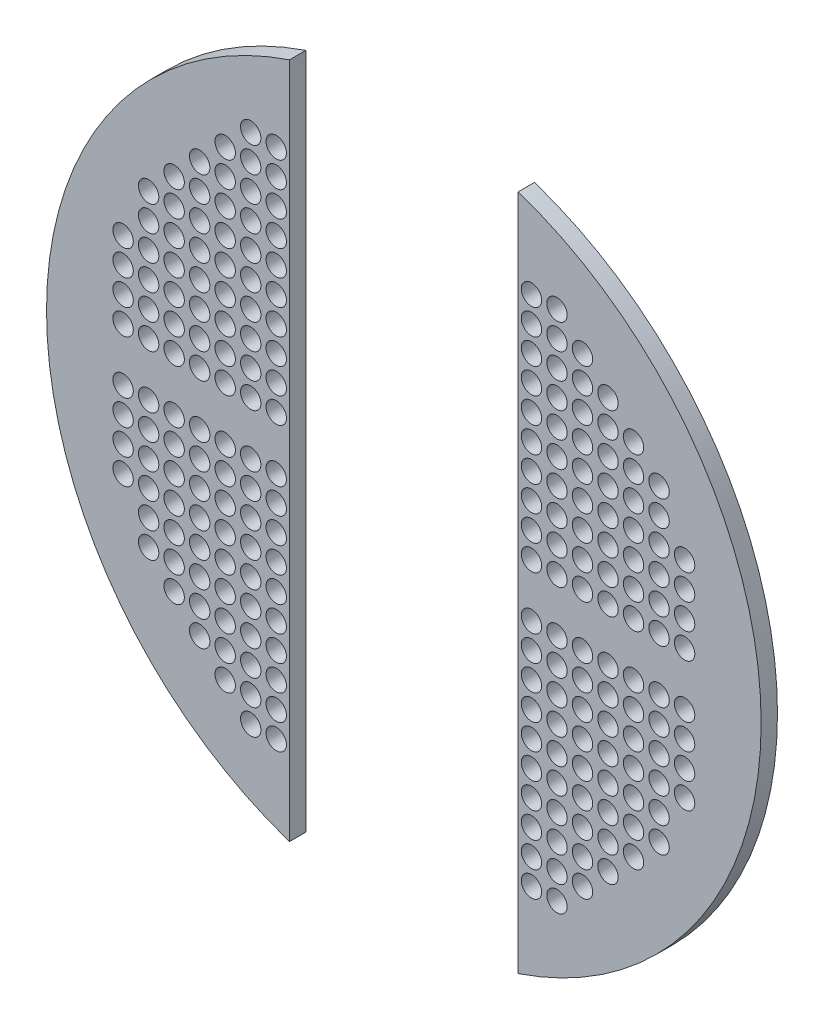
from build123d import *

# Parameters (mm, degrees)
SKETCH1_R           = 444.5
BOSS_EXTRUDE1_DEPTH = 20.32
SKETCH4_R           = 12.7
CUT_EXTRUDE1_DEPTH  = 76.2
SKETCH5_W           = 284.48
SKETCH5_H           = 949.521920759
CUT_EXTRUDE2_DEPTH  = 50.8


with BuildPart() as part:
    # Sketch1 → Boss-Extrude1 (new body)
    with BuildSketch(Plane.XY):
        Circle(SKETCH1_R)
    extrude(amount=-BOSS_EXTRUDE1_DEPTH)

    # Sketch4 → Cut-Extrude1 (cut)
    with BuildSketch(Plane.XY):
        with Locations((0, 33.02)):
            Circle(SKETCH4_R)
        with Locations((-31.75, 33.02)):
            Circle(SKETCH4_R)
        with Locations((-63.5, 33.02)):
            Circle(SKETCH4_R)
        with Locations((-95.25, 33.02)):
            Circle(SKETCH4_R)
        with Locations((-127, 33.02)):
            Circle(SKETCH4_R)
        with Locations((-158.75, 33.02)):
            Circle(SKETCH4_R)
        with Locations((-190.5, 33.02)):
            Circle(SKETCH4_R)
        with Locations((-222.25, 33.02)):
            Circle(SKETCH4_R)
        with Locations((-254, 33.02)):
            Circle(SKETCH4_R)
        with Locations((-285.75, 33.02)):
            Circle(SKETCH4_R)
        with Locations((-317.5, 33.02)):
            Circle(SKETCH4_R)
        with Locations((-349.25, 33.02)):
            Circle(SKETCH4_R)
        with Locations((-31.75, 64.77)):
            Circle(SKETCH4_R)
        with Locations((-63.5, 64.77)):
            Circle(SKETCH4_R)
        with Locations((-95.25, 64.77)):
            Circle(SKETCH4_R)
        with Locations((-127, 64.77)):
            Circle(SKETCH4_R)
        with Locations((-158.75, 64.77)):
            Circle(SKETCH4_R)
        with Locations((-190.5, 64.77)):
            Circle(SKETCH4_R)
        with Locations((-222.25, 64.77)):
            Circle(SKETCH4_R)
        with Locations((-254, 64.77)):
            Circle(SKETCH4_R)
        with Locations((-285.75, 64.77)):
            Circle(SKETCH4_R)
        with Locations((-317.5, 64.77)):
            Circle(SKETCH4_R)
        with Locations((-349.25, 64.77)):
            Circle(SKETCH4_R)
        with Locations((-31.75, 96.52)):
            Circle(SKETCH4_R)
        with Locations((-63.5, 96.52)):
            Circle(SKETCH4_R)
        with Locations((-95.25, 96.52)):
            Circle(SKETCH4_R)
        with Locations((-127, 96.52)):
            Circle(SKETCH4_R)
        with Locations((-158.75, 96.52)):
            Circle(SKETCH4_R)
        with Locations((-190.5, 96.52)):
            Circle(SKETCH4_R)
        with Locations((-222.25, 96.52)):
            Circle(SKETCH4_R)
        with Locations((-254, 96.52)):
            Circle(SKETCH4_R)
        with Locations((-285.75, 96.52)):
            Circle(SKETCH4_R)
        with Locations((-317.5, 96.52)):
            Circle(SKETCH4_R)
        with Locations((-349.25, 96.52)):
            Circle(SKETCH4_R)
        with Locations((-31.75, 128.27)):
            Circle(SKETCH4_R)
        with Locations((-63.5, 128.27)):
            Circle(SKETCH4_R)
        with Locations((-95.25, 128.27)):
            Circle(SKETCH4_R)
        with Locations((-127, 128.27)):
            Circle(SKETCH4_R)
        with Locations((-158.75, 128.27)):
            Circle(SKETCH4_R)
        with Locations((-190.5, 128.27)):
            Circle(SKETCH4_R)
        with Locations((-222.25, 128.27)):
            Circle(SKETCH4_R)
        with Locations((-254, 128.27)):
            Circle(SKETCH4_R)
        with Locations((-285.75, 128.27)):
            Circle(SKETCH4_R)
        with Locations((-317.5, 128.27)):
            Circle(SKETCH4_R)
        with Locations((-349.25, 128.27)):
            Circle(SKETCH4_R)
        with Locations((-31.75, 160.02)):
            Circle(SKETCH4_R)
        with Locations((-63.5, 160.02)):
            Circle(SKETCH4_R)
        with Locations((-95.25, 160.02)):
            Circle(SKETCH4_R)
        with Locations((-127, 160.02)):
            Circle(SKETCH4_R)
        with Locations((-158.75, 160.02)):
            Circle(SKETCH4_R)
        with Locations((-190.5, 160.02)):
            Circle(SKETCH4_R)
        with Locations((-222.25, 160.02)):
            Circle(SKETCH4_R)
        with Locations((-254, 160.02)):
            Circle(SKETCH4_R)
        with Locations((-285.75, 160.02)):
            Circle(SKETCH4_R)
        with Locations((-317.5, 160.02)):
            Circle(SKETCH4_R)
        with Locations((-31.75, 191.77)):
            Circle(SKETCH4_R)
        with Locations((-63.5, 191.77)):
            Circle(SKETCH4_R)
        with Locations((-95.25, 191.77)):
            Circle(SKETCH4_R)
        with Locations((-127, 191.77)):
            Circle(SKETCH4_R)
        with Locations((-158.75, 191.77)):
            Circle(SKETCH4_R)
        with Locations((-190.5, 191.77)):
            Circle(SKETCH4_R)
        with Locations((-222.25, 191.77)):
            Circle(SKETCH4_R)
        with Locations((-254, 191.77)):
            Circle(SKETCH4_R)
        with Locations((-285.75, 191.77)):
            Circle(SKETCH4_R)
        with Locations((-317.5, 191.77)):
            Circle(SKETCH4_R)
        with Locations((-31.75, 223.52)):
            Circle(SKETCH4_R)
        with Locations((-63.5, 223.52)):
            Circle(SKETCH4_R)
        with Locations((-95.25, 223.52)):
            Circle(SKETCH4_R)
        with Locations((-127, 223.52)):
            Circle(SKETCH4_R)
        with Locations((-158.75, 223.52)):
            Circle(SKETCH4_R)
        with Locations((-190.5, 223.52)):
            Circle(SKETCH4_R)
        with Locations((-222.25, 223.52)):
            Circle(SKETCH4_R)
        with Locations((-254, 223.52)):
            Circle(SKETCH4_R)
        with Locations((-285.75, 223.52)):
            Circle(SKETCH4_R)
        with Locations((-31.75, 255.27)):
            Circle(SKETCH4_R)
        with Locations((-63.5, 255.27)):
            Circle(SKETCH4_R)
        with Locations((-95.25, 255.27)):
            Circle(SKETCH4_R)
        with Locations((-127, 255.27)):
            Circle(SKETCH4_R)
        with Locations((-158.75, 255.27)):
            Circle(SKETCH4_R)
        with Locations((-190.5, 255.27)):
            Circle(SKETCH4_R)
        with Locations((-222.25, 255.27)):
            Circle(SKETCH4_R)
        with Locations((-254, 255.27)):
            Circle(SKETCH4_R)
        with Locations((-31.75, 287.02)):
            Circle(SKETCH4_R)
        with Locations((-63.5, 287.02)):
            Circle(SKETCH4_R)
        with Locations((-95.25, 287.02)):
            Circle(SKETCH4_R)
        with Locations((-127, 287.02)):
            Circle(SKETCH4_R)
        with Locations((-158.75, 287.02)):
            Circle(SKETCH4_R)
        with Locations((-190.5, 287.02)):
            Circle(SKETCH4_R)
        with Locations((-222.25, 287.02)):
            Circle(SKETCH4_R)
        with Locations((-31.75, 318.77)):
            Circle(SKETCH4_R)
        with Locations((-63.5, 318.77)):
            Circle(SKETCH4_R)
        with Locations((-95.25, 318.77)):
            Circle(SKETCH4_R)
        with Locations((-127, 318.77)):
            Circle(SKETCH4_R)
        with Locations((-158.75, 318.77)):
            Circle(SKETCH4_R)
        with Locations((-190.5, 318.77)):
            Circle(SKETCH4_R)
        with Locations((-31.75, 350.52)):
            Circle(SKETCH4_R)
        with Locations((-63.5, 350.52)):
            Circle(SKETCH4_R)
        with Locations((-95.25, 350.52)):
            Circle(SKETCH4_R)
        with Locations((-127, 350.52)):
            Circle(SKETCH4_R)
        with Locations((-31.75, 382.27)):
            Circle(SKETCH4_R)
        with Locations((0, 64.77)):
            Circle(SKETCH4_R)
        with Locations((0, 96.52)):
            Circle(SKETCH4_R)
        with Locations((0, 128.27)):
            Circle(SKETCH4_R)
        with Locations((0, 160.02)):
            Circle(SKETCH4_R)
        with Locations((0, 191.77)):
            Circle(SKETCH4_R)
        with Locations((0, 223.52)):
            Circle(SKETCH4_R)
        with Locations((0, 255.27)):
            Circle(SKETCH4_R)
        with Locations((0, 287.02)):
            Circle(SKETCH4_R)
        with Locations((0, 318.77)):
            Circle(SKETCH4_R)
        with Locations((0, 350.52)):
            Circle(SKETCH4_R)
        with Locations((0, 382.27)):
            Circle(SKETCH4_R)
        with Locations((63.5, 350.52)):
            Circle(SKETCH4_R)
        with Locations((31.75, 350.52)):
            Circle(SKETCH4_R)
        with Locations((63.5, 318.77)):
            Circle(SKETCH4_R)
        with Locations((31.75, 318.77)):
            Circle(SKETCH4_R)
        with Locations((31.75, 287.02)):
            Circle(SKETCH4_R)
        with Locations((63.5, 255.27)):
            Circle(SKETCH4_R)
        with Locations((31.75, 255.27)):
            Circle(SKETCH4_R)
        with Locations((63.5, 223.52)):
            Circle(SKETCH4_R)
        with Locations((31.75, 223.52)):
            Circle(SKETCH4_R)
        with Locations((31.75, 191.77)):
            Circle(SKETCH4_R)
        with Locations((63.5, 160.02)):
            Circle(SKETCH4_R)
        with Locations((31.75, 160.02)):
            Circle(SKETCH4_R)
        with Locations((63.5, 128.27)):
            Circle(SKETCH4_R)
        with Locations((31.75, 128.27)):
            Circle(SKETCH4_R)
        with Locations((349.25, 96.52)):
            Circle(SKETCH4_R)
        with Locations((317.5, 96.52)):
            Circle(SKETCH4_R)
        with Locations((285.75, 96.52)):
            Circle(SKETCH4_R)
        with Locations((254, 96.52)):
            Circle(SKETCH4_R)
        with Locations((222.25, 96.52)):
            Circle(SKETCH4_R)
        with Locations((190.5, 96.52)):
            Circle(SKETCH4_R)
        with Locations((158.75, 96.52)):
            Circle(SKETCH4_R)
        with Locations((127, 96.52)):
            Circle(SKETCH4_R)
        with Locations((95.25, 96.52)):
            Circle(SKETCH4_R)
        with Locations((63.5, 96.52)):
            Circle(SKETCH4_R)
        with Locations((31.75, 96.52)):
            Circle(SKETCH4_R)
        with Locations((349.25, 64.77)):
            Circle(SKETCH4_R)
        with Locations((317.5, 64.77)):
            Circle(SKETCH4_R)
        with Locations((285.75, 64.77)):
            Circle(SKETCH4_R)
        with Locations((254, 64.77)):
            Circle(SKETCH4_R)
        with Locations((222.25, 64.77)):
            Circle(SKETCH4_R)
        with Locations((190.5, 64.77)):
            Circle(SKETCH4_R)
        with Locations((158.75, 64.77)):
            Circle(SKETCH4_R)
        with Locations((127, 64.77)):
            Circle(SKETCH4_R)
        with Locations((95.25, 64.77)):
            Circle(SKETCH4_R)
        with Locations((63.5, 64.77)):
            Circle(SKETCH4_R)
        with Locations((31.75, 64.77)):
            Circle(SKETCH4_R)
        with Locations((349.25, 33.02)):
            Circle(SKETCH4_R)
        with Locations((317.5, 33.02)):
            Circle(SKETCH4_R)
        with Locations((285.75, 33.02)):
            Circle(SKETCH4_R)
        with Locations((254, 33.02)):
            Circle(SKETCH4_R)
        with Locations((222.25, 33.02)):
            Circle(SKETCH4_R)
        with Locations((190.5, 33.02)):
            Circle(SKETCH4_R)
        with Locations((158.75, 33.02)):
            Circle(SKETCH4_R)
        with Locations((127, 33.02)):
            Circle(SKETCH4_R)
        with Locations((95.25, 33.02)):
            Circle(SKETCH4_R)
        with Locations((63.5, 33.02)):
            Circle(SKETCH4_R)
        with Locations((31.75, 33.02)):
            Circle(SKETCH4_R)
        with Locations((127, 350.52)):
            Circle(SKETCH4_R)
        with Locations((95.25, 350.52)):
            Circle(SKETCH4_R)
        with Locations((190.5, 318.77)):
            Circle(SKETCH4_R)
        with Locations((127, 318.77)):
            Circle(SKETCH4_R)
        with Locations((95.25, 318.77)):
            Circle(SKETCH4_R)
        with Locations((222.25, 287.02)):
            Circle(SKETCH4_R)
        with Locations((190.5, 287.02)):
            Circle(SKETCH4_R)
        with Locations((158.75, 287.02)):
            Circle(SKETCH4_R)
        with Locations((95.25, 287.02)):
            Circle(SKETCH4_R)
        with Locations((254, 255.27)):
            Circle(SKETCH4_R)
        with Locations((222.25, 255.27)):
            Circle(SKETCH4_R)
        with Locations((190.5, 255.27)):
            Circle(SKETCH4_R)
        with Locations((158.75, 255.27)):
            Circle(SKETCH4_R)
        with Locations((127, 255.27)):
            Circle(SKETCH4_R)
        with Locations((95.25, 255.27)):
            Circle(SKETCH4_R)
        with Locations((285.75, 223.52)):
            Circle(SKETCH4_R)
        with Locations((254, 223.52)):
            Circle(SKETCH4_R)
        with Locations((222.25, 223.52)):
            Circle(SKETCH4_R)
        with Locations((158.75, 223.52)):
            Circle(SKETCH4_R)
        with Locations((127, 223.52)):
            Circle(SKETCH4_R)
        with Locations((95.25, 223.52)):
            Circle(SKETCH4_R)
        with Locations((317.5, 191.77)):
            Circle(SKETCH4_R)
        with Locations((285.75, 191.77)):
            Circle(SKETCH4_R)
        with Locations((254, 191.77)):
            Circle(SKETCH4_R)
        with Locations((222.25, 191.77)):
            Circle(SKETCH4_R)
        with Locations((190.5, 191.77)):
            Circle(SKETCH4_R)
        with Locations((158.75, 191.77)):
            Circle(SKETCH4_R)
        with Locations((127, 191.77)):
            Circle(SKETCH4_R)
        with Locations((95.25, 191.77)):
            Circle(SKETCH4_R)
        with Locations((317.5, 160.02)):
            Circle(SKETCH4_R)
        with Locations((285.75, 160.02)):
            Circle(SKETCH4_R)
        with Locations((254, 160.02)):
            Circle(SKETCH4_R)
        with Locations((222.25, 160.02)):
            Circle(SKETCH4_R)
        with Locations((190.5, 160.02)):
            Circle(SKETCH4_R)
        with Locations((158.75, 160.02)):
            Circle(SKETCH4_R)
        with Locations((127, 160.02)):
            Circle(SKETCH4_R)
        with Locations((95.25, 160.02)):
            Circle(SKETCH4_R)
        with Locations((349.25, 128.27)):
            Circle(SKETCH4_R)
        with Locations((317.5, 128.27)):
            Circle(SKETCH4_R)
        with Locations((285.75, 128.27)):
            Circle(SKETCH4_R)
        with Locations((254, 128.27)):
            Circle(SKETCH4_R)
        with Locations((222.25, 128.27)):
            Circle(SKETCH4_R)
        with Locations((190.5, 128.27)):
            Circle(SKETCH4_R)
        with Locations((158.75, 128.27)):
            Circle(SKETCH4_R)
        with Locations((127, 128.27)):
            Circle(SKETCH4_R)
        with Locations((95.25, 128.27)):
            Circle(SKETCH4_R)
        with Locations((127, 287.02)):
            Circle(SKETCH4_R)
        with Locations((63.5, 287.02)):
            Circle(SKETCH4_R)
        with Locations((63.5, 191.77)):
            Circle(SKETCH4_R)
        with Locations((190.5, 223.52)):
            Circle(SKETCH4_R)
        with Locations((158.75, 318.77)):
            Circle(SKETCH4_R)
        with Locations((31.75, 382.27)):
            Circle(SKETCH4_R)
        with Locations((31.75, -382.27)):
            Circle(SKETCH4_R)
        with Locations((158.75, -318.77)):
            Circle(SKETCH4_R)
        with Locations((190.5, -223.52)):
            Circle(SKETCH4_R)
        with Locations((63.5, -191.77)):
            Circle(SKETCH4_R)
        with Locations((63.5, -287.02)):
            Circle(SKETCH4_R)
        with Locations((127, -287.02)):
            Circle(SKETCH4_R)
        with Locations((95.25, -128.27)):
            Circle(SKETCH4_R)
        with Locations((127, -128.27)):
            Circle(SKETCH4_R)
        with Locations((158.75, -128.27)):
            Circle(SKETCH4_R)
        with Locations((190.5, -128.27)):
            Circle(SKETCH4_R)
        with Locations((222.25, -128.27)):
            Circle(SKETCH4_R)
        with Locations((254, -128.27)):
            Circle(SKETCH4_R)
        with Locations((285.75, -128.27)):
            Circle(SKETCH4_R)
        with Locations((317.5, -128.27)):
            Circle(SKETCH4_R)
        with Locations((349.25, -128.27)):
            Circle(SKETCH4_R)
        with Locations((95.25, -160.02)):
            Circle(SKETCH4_R)
        with Locations((127, -160.02)):
            Circle(SKETCH4_R)
        with Locations((158.75, -160.02)):
            Circle(SKETCH4_R)
        with Locations((190.5, -160.02)):
            Circle(SKETCH4_R)
        with Locations((222.25, -160.02)):
            Circle(SKETCH4_R)
        with Locations((254, -160.02)):
            Circle(SKETCH4_R)
        with Locations((285.75, -160.02)):
            Circle(SKETCH4_R)
        with Locations((317.5, -160.02)):
            Circle(SKETCH4_R)
        with Locations((95.25, -191.77)):
            Circle(SKETCH4_R)
        with Locations((127, -191.77)):
            Circle(SKETCH4_R)
        with Locations((158.75, -191.77)):
            Circle(SKETCH4_R)
        with Locations((190.5, -191.77)):
            Circle(SKETCH4_R)
        with Locations((222.25, -191.77)):
            Circle(SKETCH4_R)
        with Locations((254, -191.77)):
            Circle(SKETCH4_R)
        with Locations((285.75, -191.77)):
            Circle(SKETCH4_R)
        with Locations((317.5, -191.77)):
            Circle(SKETCH4_R)
        with Locations((95.25, -223.52)):
            Circle(SKETCH4_R)
        with Locations((127, -223.52)):
            Circle(SKETCH4_R)
        with Locations((158.75, -223.52)):
            Circle(SKETCH4_R)
        with Locations((222.25, -223.52)):
            Circle(SKETCH4_R)
        with Locations((254, -223.52)):
            Circle(SKETCH4_R)
        with Locations((285.75, -223.52)):
            Circle(SKETCH4_R)
        with Locations((95.25, -255.27)):
            Circle(SKETCH4_R)
        with Locations((127, -255.27)):
            Circle(SKETCH4_R)
        with Locations((158.75, -255.27)):
            Circle(SKETCH4_R)
        with Locations((190.5, -255.27)):
            Circle(SKETCH4_R)
        with Locations((222.25, -255.27)):
            Circle(SKETCH4_R)
        with Locations((254, -255.27)):
            Circle(SKETCH4_R)
        with Locations((95.25, -287.02)):
            Circle(SKETCH4_R)
        with Locations((158.75, -287.02)):
            Circle(SKETCH4_R)
        with Locations((190.5, -287.02)):
            Circle(SKETCH4_R)
        with Locations((222.25, -287.02)):
            Circle(SKETCH4_R)
        with Locations((95.25, -318.77)):
            Circle(SKETCH4_R)
        with Locations((127, -318.77)):
            Circle(SKETCH4_R)
        with Locations((190.5, -318.77)):
            Circle(SKETCH4_R)
        with Locations((95.25, -350.52)):
            Circle(SKETCH4_R)
        with Locations((127, -350.52)):
            Circle(SKETCH4_R)
        with Locations((31.75, -33.02)):
            Circle(SKETCH4_R)
        with Locations((63.5, -33.02)):
            Circle(SKETCH4_R)
        with Locations((95.25, -33.02)):
            Circle(SKETCH4_R)
        with Locations((127, -33.02)):
            Circle(SKETCH4_R)
        with Locations((158.75, -33.02)):
            Circle(SKETCH4_R)
        with Locations((190.5, -33.02)):
            Circle(SKETCH4_R)
        with Locations((222.25, -33.02)):
            Circle(SKETCH4_R)
        with Locations((254, -33.02)):
            Circle(SKETCH4_R)
        with Locations((285.75, -33.02)):
            Circle(SKETCH4_R)
        with Locations((317.5, -33.02)):
            Circle(SKETCH4_R)
        with Locations((349.25, -33.02)):
            Circle(SKETCH4_R)
        with Locations((31.75, -64.77)):
            Circle(SKETCH4_R)
        with Locations((63.5, -64.77)):
            Circle(SKETCH4_R)
        with Locations((95.25, -64.77)):
            Circle(SKETCH4_R)
        with Locations((127, -64.77)):
            Circle(SKETCH4_R)
        with Locations((158.75, -64.77)):
            Circle(SKETCH4_R)
        with Locations((190.5, -64.77)):
            Circle(SKETCH4_R)
        with Locations((222.25, -64.77)):
            Circle(SKETCH4_R)
        with Locations((254, -64.77)):
            Circle(SKETCH4_R)
        with Locations((285.75, -64.77)):
            Circle(SKETCH4_R)
        with Locations((317.5, -64.77)):
            Circle(SKETCH4_R)
        with Locations((349.25, -64.77)):
            Circle(SKETCH4_R)
        with Locations((31.75, -96.52)):
            Circle(SKETCH4_R)
        with Locations((63.5, -96.52)):
            Circle(SKETCH4_R)
        with Locations((95.25, -96.52)):
            Circle(SKETCH4_R)
        with Locations((127, -96.52)):
            Circle(SKETCH4_R)
        with Locations((158.75, -96.52)):
            Circle(SKETCH4_R)
        with Locations((190.5, -96.52)):
            Circle(SKETCH4_R)
        with Locations((222.25, -96.52)):
            Circle(SKETCH4_R)
        with Locations((254, -96.52)):
            Circle(SKETCH4_R)
        with Locations((285.75, -96.52)):
            Circle(SKETCH4_R)
        with Locations((317.5, -96.52)):
            Circle(SKETCH4_R)
        with Locations((349.25, -96.52)):
            Circle(SKETCH4_R)
        with Locations((31.75, -128.27)):
            Circle(SKETCH4_R)
        with Locations((63.5, -128.27)):
            Circle(SKETCH4_R)
        with Locations((31.75, -160.02)):
            Circle(SKETCH4_R)
        with Locations((63.5, -160.02)):
            Circle(SKETCH4_R)
        with Locations((31.75, -191.77)):
            Circle(SKETCH4_R)
        with Locations((31.75, -223.52)):
            Circle(SKETCH4_R)
        with Locations((63.5, -223.52)):
            Circle(SKETCH4_R)
        with Locations((31.75, -255.27)):
            Circle(SKETCH4_R)
        with Locations((63.5, -255.27)):
            Circle(SKETCH4_R)
        with Locations((31.75, -287.02)):
            Circle(SKETCH4_R)
        with Locations((31.75, -318.77)):
            Circle(SKETCH4_R)
        with Locations((63.5, -318.77)):
            Circle(SKETCH4_R)
        with Locations((31.75, -350.52)):
            Circle(SKETCH4_R)
        with Locations((63.5, -350.52)):
            Circle(SKETCH4_R)
        with Locations((0, -382.27)):
            Circle(SKETCH4_R)
        with Locations((0, -350.52)):
            Circle(SKETCH4_R)
        with Locations((0, -318.77)):
            Circle(SKETCH4_R)
        with Locations((0, -287.02)):
            Circle(SKETCH4_R)
        with Locations((0, -255.27)):
            Circle(SKETCH4_R)
        with Locations((0, -223.52)):
            Circle(SKETCH4_R)
        with Locations((0, -191.77)):
            Circle(SKETCH4_R)
        with Locations((0, -160.02)):
            Circle(SKETCH4_R)
        with Locations((0, -128.27)):
            Circle(SKETCH4_R)
        with Locations((0, -96.52)):
            Circle(SKETCH4_R)
        with Locations((0, -64.77)):
            Circle(SKETCH4_R)
        with Locations((-31.75, -382.27)):
            Circle(SKETCH4_R)
        with Locations((-127, -350.52)):
            Circle(SKETCH4_R)
        with Locations((-95.25, -350.52)):
            Circle(SKETCH4_R)
        with Locations((-63.5, -350.52)):
            Circle(SKETCH4_R)
        with Locations((-31.75, -350.52)):
            Circle(SKETCH4_R)
        with Locations((-190.5, -318.77)):
            Circle(SKETCH4_R)
        with Locations((-158.75, -318.77)):
            Circle(SKETCH4_R)
        with Locations((-127, -318.77)):
            Circle(SKETCH4_R)
        with Locations((-95.25, -318.77)):
            Circle(SKETCH4_R)
        with Locations((-63.5, -318.77)):
            Circle(SKETCH4_R)
        with Locations((-31.75, -318.77)):
            Circle(SKETCH4_R)
        with Locations((-222.25, -287.02)):
            Circle(SKETCH4_R)
        with Locations((-190.5, -287.02)):
            Circle(SKETCH4_R)
        with Locations((-158.75, -287.02)):
            Circle(SKETCH4_R)
        with Locations((-127, -287.02)):
            Circle(SKETCH4_R)
        with Locations((-95.25, -287.02)):
            Circle(SKETCH4_R)
        with Locations((-63.5, -287.02)):
            Circle(SKETCH4_R)
        with Locations((-31.75, -287.02)):
            Circle(SKETCH4_R)
        with Locations((-254, -255.27)):
            Circle(SKETCH4_R)
        with Locations((-222.25, -255.27)):
            Circle(SKETCH4_R)
        with Locations((-190.5, -255.27)):
            Circle(SKETCH4_R)
        with Locations((-158.75, -255.27)):
            Circle(SKETCH4_R)
        with Locations((-127, -255.27)):
            Circle(SKETCH4_R)
        with Locations((-95.25, -255.27)):
            Circle(SKETCH4_R)
        with Locations((-63.5, -255.27)):
            Circle(SKETCH4_R)
        with Locations((-31.75, -255.27)):
            Circle(SKETCH4_R)
        with Locations((-285.75, -223.52)):
            Circle(SKETCH4_R)
        with Locations((-254, -223.52)):
            Circle(SKETCH4_R)
        with Locations((-222.25, -223.52)):
            Circle(SKETCH4_R)
        with Locations((-190.5, -223.52)):
            Circle(SKETCH4_R)
        with Locations((-158.75, -223.52)):
            Circle(SKETCH4_R)
        with Locations((-127, -223.52)):
            Circle(SKETCH4_R)
        with Locations((-95.25, -223.52)):
            Circle(SKETCH4_R)
        with Locations((-63.5, -223.52)):
            Circle(SKETCH4_R)
        with Locations((-31.75, -223.52)):
            Circle(SKETCH4_R)
        with Locations((-317.5, -191.77)):
            Circle(SKETCH4_R)
        with Locations((-285.75, -191.77)):
            Circle(SKETCH4_R)
        with Locations((-254, -191.77)):
            Circle(SKETCH4_R)
        with Locations((-222.25, -191.77)):
            Circle(SKETCH4_R)
        with Locations((-190.5, -191.77)):
            Circle(SKETCH4_R)
        with Locations((-158.75, -191.77)):
            Circle(SKETCH4_R)
        with Locations((-127, -191.77)):
            Circle(SKETCH4_R)
        with Locations((-95.25, -191.77)):
            Circle(SKETCH4_R)
        with Locations((-63.5, -191.77)):
            Circle(SKETCH4_R)
        with Locations((-31.75, -191.77)):
            Circle(SKETCH4_R)
        with Locations((-317.5, -160.02)):
            Circle(SKETCH4_R)
        with Locations((-285.75, -160.02)):
            Circle(SKETCH4_R)
        with Locations((-254, -160.02)):
            Circle(SKETCH4_R)
        with Locations((-222.25, -160.02)):
            Circle(SKETCH4_R)
        with Locations((-190.5, -160.02)):
            Circle(SKETCH4_R)
        with Locations((-158.75, -160.02)):
            Circle(SKETCH4_R)
        with Locations((-127, -160.02)):
            Circle(SKETCH4_R)
        with Locations((-95.25, -160.02)):
            Circle(SKETCH4_R)
        with Locations((-63.5, -160.02)):
            Circle(SKETCH4_R)
        with Locations((-31.75, -160.02)):
            Circle(SKETCH4_R)
        with Locations((-349.25, -128.27)):
            Circle(SKETCH4_R)
        with Locations((-317.5, -128.27)):
            Circle(SKETCH4_R)
        with Locations((-285.75, -128.27)):
            Circle(SKETCH4_R)
        with Locations((-254, -128.27)):
            Circle(SKETCH4_R)
        with Locations((-222.25, -128.27)):
            Circle(SKETCH4_R)
        with Locations((-190.5, -128.27)):
            Circle(SKETCH4_R)
        with Locations((-158.75, -128.27)):
            Circle(SKETCH4_R)
        with Locations((-127, -128.27)):
            Circle(SKETCH4_R)
        with Locations((-95.25, -128.27)):
            Circle(SKETCH4_R)
        with Locations((-63.5, -128.27)):
            Circle(SKETCH4_R)
        with Locations((-31.75, -128.27)):
            Circle(SKETCH4_R)
        with Locations((-349.25, -96.52)):
            Circle(SKETCH4_R)
        with Locations((-317.5, -96.52)):
            Circle(SKETCH4_R)
        with Locations((-285.75, -96.52)):
            Circle(SKETCH4_R)
        with Locations((-254, -96.52)):
            Circle(SKETCH4_R)
        with Locations((-222.25, -96.52)):
            Circle(SKETCH4_R)
        with Locations((-190.5, -96.52)):
            Circle(SKETCH4_R)
        with Locations((-158.75, -96.52)):
            Circle(SKETCH4_R)
        with Locations((-127, -96.52)):
            Circle(SKETCH4_R)
        with Locations((-95.25, -96.52)):
            Circle(SKETCH4_R)
        with Locations((-63.5, -96.52)):
            Circle(SKETCH4_R)
        with Locations((-31.75, -96.52)):
            Circle(SKETCH4_R)
        with Locations((-349.25, -64.77)):
            Circle(SKETCH4_R)
        with Locations((-317.5, -64.77)):
            Circle(SKETCH4_R)
        with Locations((-285.75, -64.77)):
            Circle(SKETCH4_R)
        with Locations((-254, -64.77)):
            Circle(SKETCH4_R)
        with Locations((-222.25, -64.77)):
            Circle(SKETCH4_R)
        with Locations((-190.5, -64.77)):
            Circle(SKETCH4_R)
        with Locations((-158.75, -64.77)):
            Circle(SKETCH4_R)
        with Locations((-127, -64.77)):
            Circle(SKETCH4_R)
        with Locations((-95.25, -64.77)):
            Circle(SKETCH4_R)
        with Locations((-63.5, -64.77)):
            Circle(SKETCH4_R)
        with Locations((-31.75, -64.77)):
            Circle(SKETCH4_R)
        with Locations((-349.25, -33.02)):
            Circle(SKETCH4_R)
        with Locations((-317.5, -33.02)):
            Circle(SKETCH4_R)
        with Locations((-285.75, -33.02)):
            Circle(SKETCH4_R)
        with Locations((-254, -33.02)):
            Circle(SKETCH4_R)
        with Locations((-222.25, -33.02)):
            Circle(SKETCH4_R)
        with Locations((-190.5, -33.02)):
            Circle(SKETCH4_R)
        with Locations((-158.75, -33.02)):
            Circle(SKETCH4_R)
        with Locations((-127, -33.02)):
            Circle(SKETCH4_R)
        with Locations((-95.25, -33.02)):
            Circle(SKETCH4_R)
        with Locations((-63.5, -33.02)):
            Circle(SKETCH4_R)
        with Locations((-31.75, -33.02)):
            Circle(SKETCH4_R)
        with Locations((0, -33.02)):
            Circle(SKETCH4_R)
    extrude(amount=-CUT_EXTRUDE1_DEPTH, mode=Mode.SUBTRACT)

    # Sketch5 → Cut-Extrude2 (cut)
    with BuildSketch(Plane.XY):
        with Locations((0, 4.378313314)):
            Rectangle(SKETCH5_W, SKETCH5_H)
    extrude(amount=-CUT_EXTRUDE2_DEPTH, mode=Mode.SUBTRACT)


with BuildPart() as cut_extrude2_piece_1:
    # of the separate pieces the step leaves, piece 1, a body of its own (cut_extrude2_pieces)
    add(part.part.solids().sort_by_distance((142.24, 421.12709768, 0))[0])


with BuildPart() as cut_extrude2_piece_2:
    # of the separate pieces the step leaves, piece 2, a body of its own (cut_extrude2_pieces)
    add(part.part.solids().sort_by_distance((-142.24, 421.12709768, 0))[0])


solid = Compound([cut_extrude2_piece_1.part, cut_extrude2_piece_2.part])
